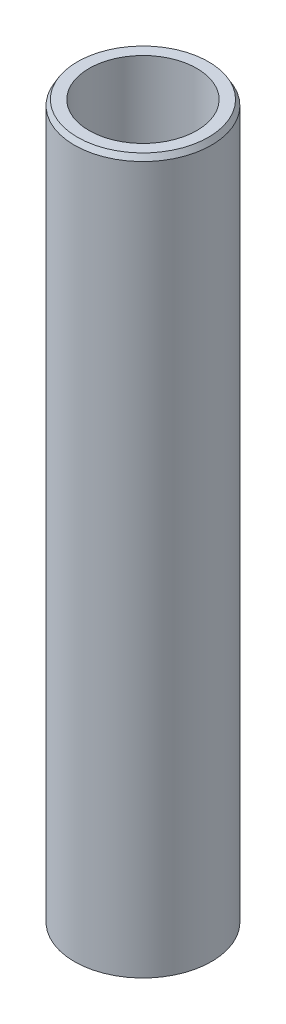
from build123d import *
from OCP.BRepFilletAPI import BRepFilletAPI_MakeChamfer

# Parameters (mm, degrees)
SKETCH1_R           = 57.5
BOSS_EXTRUDE1_DEPTH = 600
SKETCH2_R           = 45.191430008
CUT_EXTRUDE1_DEPTH  = 606.485342515
CHAMFER1_SIZE       = 4.458810909
CHAMFER1_SIZE2      = 2.574295679


with BuildPart() as part:
    # Sketch1 → Boss-Extrude1 (new body)
    with BuildSketch(Plane(origin=(0, 0, 0), x_dir=(1, 0, 0), z_dir=(0, 1, 0))):
        Circle(SKETCH1_R)
    extrude(amount=BOSS_EXTRUDE1_DEPTH)

    # Sketch2 → Cut-Extrude1 (cut, through all)
    with BuildSketch(Plane(origin=(0, 0, 0), x_dir=(1, 0, 0), z_dir=(0, 1, 0))):
        Circle(SKETCH2_R)
    extrude(amount=CUT_EXTRUDE1_DEPTH, mode=Mode.SUBTRACT)

    # Chamfer1: one chamfer whose edges measure the first distance from different faces: ONE call of the kernel's chamfer builder (chamfer() names one face for all edges)
    chamfer1_edges_1 = [part.edges().sort_by_distance(p)[0] for p in [
        (-57.5, 600, 0),
    ]]
    chamfer1_side_1 = [part.faces().sort_by_distance(p)[0] for p in [
        (-57.5, 300, 0),
    ]]
    chamfer1_edges_2 = [part.edges().sort_by_distance(p)[0] for p in [
        (-57.5, 0, 0),
    ]]
    chamfer1_side_2 = [part.faces().sort_by_distance(p)[0] for p in [
        (-55.873654403, 0, 0),
    ]]
    chamfer1 = BRepFilletAPI_MakeChamfer(part.part.solid().wrapped)
    for e in chamfer1_edges_1:
        chamfer1.Add(CHAMFER1_SIZE, CHAMFER1_SIZE2, e.wrapped, chamfer1_side_1[0].wrapped)  # the first distance lies on this face
    for e in chamfer1_edges_2:
        chamfer1.Add(CHAMFER1_SIZE, CHAMFER1_SIZE2, e.wrapped, chamfer1_side_2[0].wrapped)  # the first distance lies on this face
    add(Compound.cast(chamfer1.Shape()), mode=Mode.REPLACE)


solid = part.part
